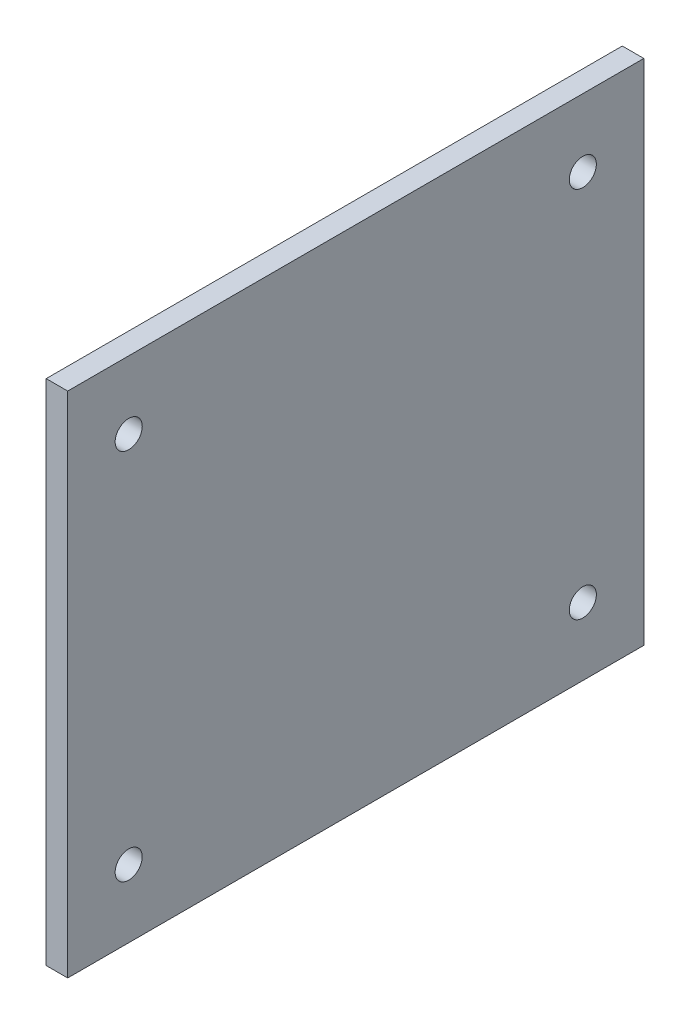
from build123d import *

# Parameters (mm, degrees)
SKETCH1_W           = 85
SKETCH1_H           = 75
SKETCH1_R           = 2
BOSS_EXTRUDE1_DEPTH = 3.175


with BuildPart() as part:
    # Sketch1 → Boss-Extrude1 (new body)
    with BuildSketch(Plane(origin=(0, 0, 0), x_dir=(0, 0, -1), z_dir=(1, 0, 0))):
        with Locations((42.5, 37.5)):
            Rectangle(SKETCH1_W, SKETCH1_H)
        with Locations((9, 65)):
            Circle(SKETCH1_R, mode=Mode.SUBTRACT)
        with Locations((9, 10)):
            Circle(SKETCH1_R, mode=Mode.SUBTRACT)
        with Locations((76, 10)):
            Circle(SKETCH1_R, mode=Mode.SUBTRACT)
        with Locations((76, 65)):
            Circle(SKETCH1_R, mode=Mode.SUBTRACT)
    extrude(amount=BOSS_EXTRUDE1_DEPTH)


solid = part.part
